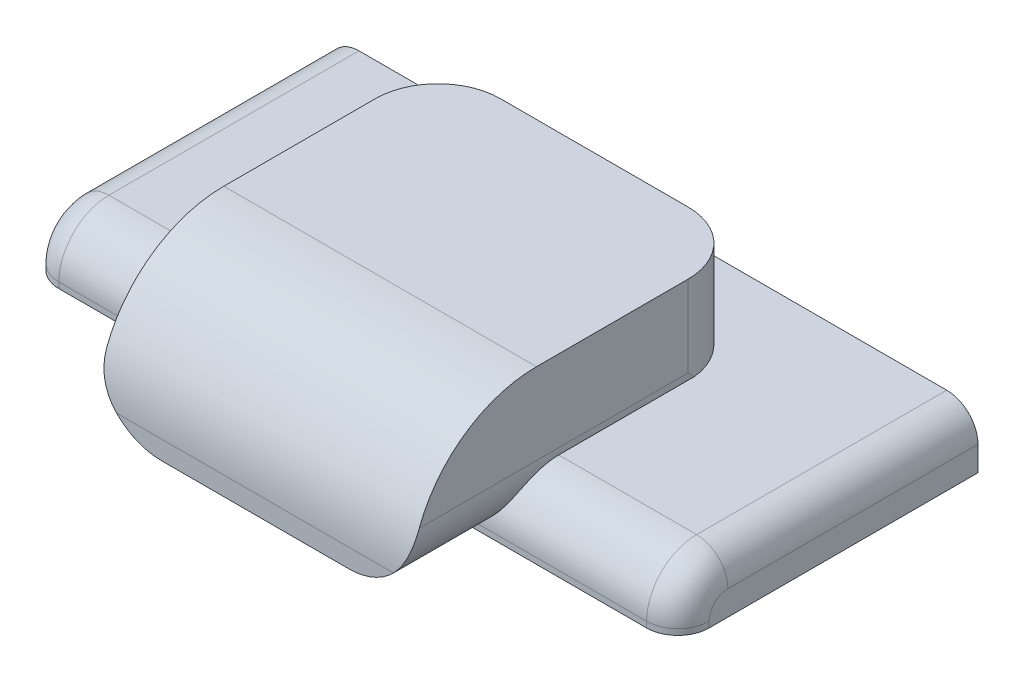
from build123d import *

# Parameters (mm, degrees)
SKETCH3_W                = 6.35
SKETCH3_H                = 6.88975
BOSS_EXTRUDE3_DEPTH      = 2.921
FILLET1_R                = 2.54
BOSS_EXTRUDE5_DEPTH      = 3.429
BOSS_EXTRUDE5_DEPTH_BACK = 9.779
SKETCH5_W                = 1.190625
SKETCH5_H                = 1.1350625
FILLET7_START            = 1.4605
FILLET7_DEPTH            = 1.984375
FILLET7_START_2          = -4.6355
FILLET7_2_DEPTH          = 6.096
FILLET7_START_3          = -3.175
FILLET7_3_DEPTH          = 0.733117551
FILLET7_START_4          = 2.441882449
FILLET7_4_DEPTH          = 0.733117551
FILLET7_START_5          = -3.4448751
FILLET7_5_DEPTH          = 4.9053751
FILLET8_R                = 1.27
FILLET10_R               = 0.635
SKETCH6_W                = 2.54
SKETCH6_H                = 1.905
CUT_EXTRUDE1_DEPTH       = 2.032


with BuildPart() as part:
    # Sketch3 → Boss-Extrude3 (new body)
    with BuildSketch(Plane(origin=(0, 0, 0), x_dir=(1, 0, 0), z_dir=(0, 1, 0))):
        Rectangle(SKETCH3_W, SKETCH3_H)
    extrude(amount=BOSS_EXTRUDE3_DEPTH)

    # Fillet1
    fillet1_edges = [part.edges().sort_by_distance(p)[0] for p in [
        (0, 2.921, 3.444875),
    ]]
    fillet(fillet1_edges, radius=FILLET1_R)

    # Sketch5 → Boss-Extrude5 (add, two sides: drawn at the far end of the back side and taken through both)
    with BuildSketch(Plane.ZY.offset(3.175).offset(-BOSS_EXTRUDE5_DEPTH_BACK)):
        with BuildLine():
            Line((-3.444875, 0), (1.4605, 0))
            Line((1.4605, 0), (1.4605, 0.1190625))
            ThreePointArc((1.4605, 0.1190625), (1.16292049, 0.83748299), (0.4445, 1.1350625))
            Line((0.4445, 1.1350625), (-3.444875, 1.1350625))
            Line((-3.444875, 1.1350625), (-3.444875, 0))
        make_face()
        with Locations((-4.0401875, 0.56753125)):
            Rectangle(SKETCH5_W, SKETCH5_H)
    extrude(amount=BOSS_EXTRUDE5_DEPTH + BOSS_EXTRUDE5_DEPTH_BACK)

    # Fillet7: read off the stored shape, not the designer's step
    # Fillet7 outline → Fillet7 (cut)
    with BuildSketch(Plane.XY.offset(FILLET7_START)):
        with BuildLine():
            Line((1.905, 0), (3.175, 0))
            Line((3.175, 0), (3.175, 1.27))
            ThreePointArc((3.175, 1.27), (2.803025612, 0.371974388), (1.905, 0))
        make_face()
        with BuildLine():
            Line((-3.175, 0), (-1.905, 0))
            ThreePointArc((-1.905, 0), (-2.803025612, 0.371974388), (-3.175, 1.27))
            Line((-3.175, 1.27), (-3.175, 0))
        make_face()
    extrude(amount=FILLET7_DEPTH, mode=Mode.SUBTRACT)

    # Fillet7 2 outline → Fillet7 2 (cut)
    with BuildSketch(Plane.XY.offset(FILLET7_START_2)):
        with BuildLine():
            ThreePointArc((3.175, 1.27), (3.173201501, 1.202435569), (3.167811099, 1.1350625))
            Line((3.167811099, 1.1350625), (3.175, 1.1350625))
            Line((3.175, 1.1350625), (3.175, 1.27))
        make_face()
        with BuildLine():
            Line((-3.175, 1.1350625), (-3.167811099, 1.1350625))
            ThreePointArc((-3.167811099, 1.1350625), (-3.173201501, 1.202435569), (-3.175, 1.27))
            Line((-3.175, 1.27), (-3.175, 1.1350625))
        make_face()
    extrude(amount=FILLET7_2_DEPTH, mode=Mode.SUBTRACT)

    # Fillet7 3 outline → Fillet7 3 (cut)
    with BuildSketch(Plane.YZ.offset(FILLET7_START_3)):
        with BuildLine():
            Line((1.1350625, 1.4605), (0.1190625, 1.4605))
            ThreePointArc((0.1190625, 1.4605), (0.83748299, 1.16292049), (1.1350625, 0.4445))
            Line((1.1350625, 0.4445), (1.1350625, 1.4605))
        make_face()
    extrude(amount=FILLET7_3_DEPTH, mode=Mode.SUBTRACT)

    # Fillet7 4 outline → Fillet7 4 (cut)
    with BuildSketch(Plane.YZ.offset(FILLET7_START_4)):
        with BuildLine():
            Line((1.1350625, 1.4605), (0.1190625, 1.4605))
            ThreePointArc((0.1190625, 1.4605), (0.83748299, 1.16292049), (1.1350625, 0.4445))
            Line((1.1350625, 0.4445), (1.1350625, 1.4605))
        make_face()
    extrude(amount=FILLET7_4_DEPTH, mode=Mode.SUBTRACT)

    # Fillet7 5 outline → Fillet7 5 (add)
    with BuildSketch(Plane.XY.offset(FILLET7_START_5)):
        with BuildLine():
            Line((2.441882449, 1.1350625), (2.441882467, 0.119062462))
            ThreePointArc((2.441882467, 0.119062462), (2.938338401, 0.531683166), (3.167811099, 1.1350625))
            Line((3.167811099, 1.1350625), (2.441882449, 1.1350625))
        make_face()
        with BuildLine():
            ThreePointArc((-3.167811099, 1.1350625), (-2.938338401, 0.531683166), (-2.441882467, 0.119062462))
            Line((-2.441882467, 0.119062462), (-2.441882449, 1.1350625))
            Line((-2.441882449, 1.1350625), (-3.167811099, 1.1350625))
        make_face()
    extrude(amount=FILLET7_5_DEPTH)

    # Fillet8
    # the kernel refuses this fillet: 1.27 mm, written as the material it takes off along each edge
    with BuildSketch(Plane(origin=(-3.175, -1.905, -3.444875), x_dir=(0, 0, 1), z_dir=(0, 1, 0))) as fillet8_piece_1_section:
        with BuildLine():
            CenterArc((FILLET8_R, FILLET8_R), FILLET8_R, 180, 90)
            Line((0, FILLET8_R), (0, 0))
            Line((0, 0), (FILLET8_R, 0))
        make_face()
    fillet8_piece_1 = extrude(amount=8.001, mode=Mode.PRIVATE)
    fillet8_piece_1 = split(fillet8_piece_1, bisect_by=Plane(origin=(-3.175, 1.1350625, -3.444875), z_dir=(0, 1, 0)), keep=Keep.TOP, mode=Mode.PRIVATE)
    add(fillet8_piece_1, mode=Mode.SUBTRACT)
    with BuildSketch(Plane(origin=(3.175, -1.905, -3.444875), x_dir=(-1, 0, 0), z_dir=(0, 1, 0))) as fillet8_piece_2_section:
        with BuildLine():
            CenterArc((FILLET8_R, FILLET8_R), FILLET8_R, 180, 90)
            Line((0, FILLET8_R), (0, 0))
            Line((0, 0), (FILLET8_R, 0))
        make_face()
    fillet8_piece_2 = extrude(amount=8.001, mode=Mode.PRIVATE)
    fillet8_piece_2 = split(fillet8_piece_2, bisect_by=Plane(origin=(3.175, 1.1350625, -3.444875), z_dir=(0, 1, 0)), keep=Keep.TOP, mode=Mode.PRIVATE)
    add(fillet8_piece_2, mode=Mode.SUBTRACT)

    # Fillet10
    fillet10_edges = [part.edges().sort_by_distance(p)[0] for p in [
        (-6.604, 0.83748299, 1.16292049),
        (-6.604, 1.1350625, -2.0955),
        (-6.604, 0.05953125, 1.4605),
        (6.604, 0.83748299, 1.16292049),
        (6.604, 0.05953125, 1.4605),
        (6.604, 1.1350625, -2.0955),
    ]]
    fillet(fillet10_edges, radius=FILLET10_R)

    # Sketch6 → Cut-Extrude1 (cut)
    with BuildSketch(Plane.XZ):
        with Locations((0, -1.2065)):
            Rectangle(SKETCH6_W, SKETCH6_H)
    extrude(amount=-CUT_EXTRUDE1_DEPTH, mode=Mode.SUBTRACT)


solid = part.part
